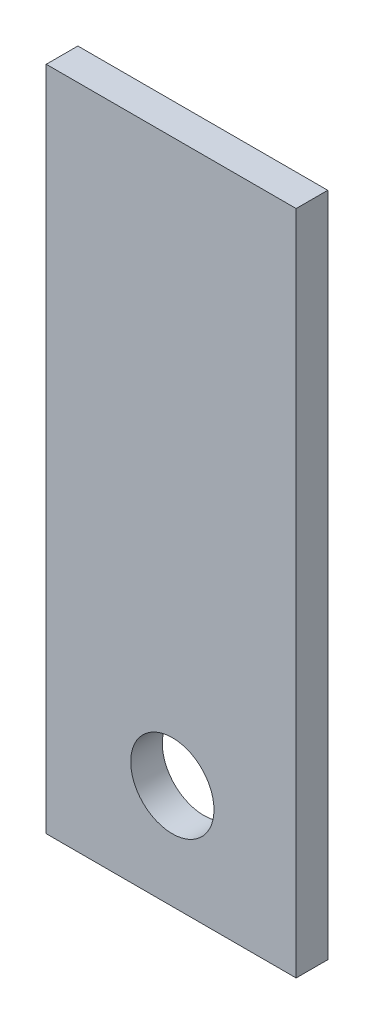
from build123d import *

# Parameters (mm, degrees)
SKETCH1_W          = 15
SKETCH1_H          = 40
BASE_FLANGE1_DEPTH = 1.89738
SKETCH6_R          = 2.5
CUT_EXTRUDE1_DEPTH = 2


# Sheet-metal steps are written as plain solids
with BuildPart() as part:
    # Sketch1 → Base-Flange1 (new body)
    with BuildSketch(Plane.XY):
        with Locations((-11.582212431, 15.652332336)):
            Rectangle(SKETCH1_W, SKETCH1_H)
    extrude(amount=-BASE_FLANGE1_DEPTH)

    # Sketch6 → Cut-Extrude1 (cut)
    with BuildSketch(Plane.XY):
        with Locations((-11.513412006, 1.931886986)):
            Circle(SKETCH6_R)
    extrude(amount=-CUT_EXTRUDE1_DEPTH, mode=Mode.SUBTRACT)


solid = part.part
